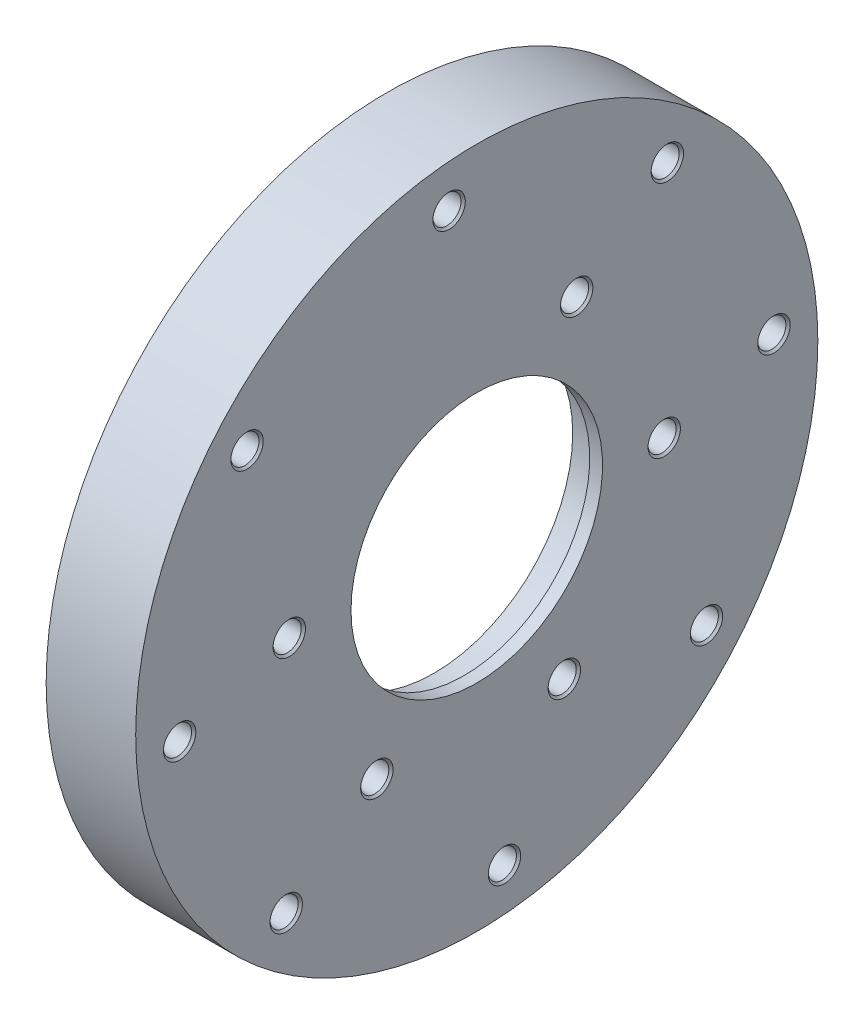
from build123d import *

# Parameters (mm, degrees)
SKETCH3_R          = 2.5
CUT_EXTRUDE1_DEPTH = 4
SKETCH6_R          = 3
CUT_EXTRUDE4_DEPTH = 11
SKETCH7_R          = 3.3
CUT_EXTRUDE5_DEPTH = 10
SKETCH9_R          = 1
CUT_EXTRUDE7_DEPTH = 2
CUT_EXTRUDE8_REACH = 117.07
SKETCH10_R         = 3.3
CHAMFER1_SIZE      = 0.5


with BuildPart() as part:
    # Sketch2 → Revolve1 (revolve)
    with BuildSketch(Plane.XY):
        Polygon((0, 80), (0, 52.5), (11, 52.5), (11, 32.5), (18, 32.5), (18, 29.5), (21, 29.5), (21, 80), align=None)
    revolve(axis=Axis((0, 0, 0), (1, 0, 0)))

    # Sketch3 → Cut-Extrude1 (cut)
    with BuildSketch(Plane.ZY):
        with Locations((0, 60)):
            Circle(SKETCH3_R)
        with Locations((12.077911205, 58.771796475)):
            Circle(SKETCH3_R)
        with Locations((23.661351307, 55.137468697)):
            Circle(SKETCH3_R)
        with Locations((34.276092906, 49.245806472)):
            Circle(SKETCH3_R)
        with Locations((43.487567234, 41.338015145)):
            Circle(SKETCH3_R)
        with Locations((50.91865545, 31.73784062)):
            Circle(SKETCH3_R)
        with Locations((56.265127929, 20.838315171)):
            Circle(SKETCH3_R)
        with Locations((59.30809946, 9.08566665)):
            Circle(SKETCH3_R)
        with Locations((59.92299043, -3.03895013)):
            Circle(SKETCH3_R)
        with Locations((58.084627132, -15.039151936)):
            Circle(SKETCH3_R)
        with Locations((53.868272374, -26.423649093)):
            Circle(SKETCH3_R)
        with Locations((47.446544216, -36.726358953)):
            Circle(SKETCH3_R)
        with Locations((39.082348963, -45.525487362)):
            Circle(SKETCH3_R)
        with Locations((29.118117752, -52.460796969)):
            Circle(SKETCH3_R)
        with Locations((17.961787378, -57.248355384)):
            Circle(SKETCH3_R)
        with Locations((6.070099319, -59.692159404)):
            Circle(SKETCH3_R)
        with Locations((-6.070099319, -59.692159404)):
            Circle(SKETCH3_R)
        with Locations((-17.961787378, -57.248355384)):
            Circle(SKETCH3_R)
        with Locations((-29.118117752, -52.460796969)):
            Circle(SKETCH3_R)
        with Locations((-39.082348963, -45.525487362)):
            Circle(SKETCH3_R)
        with Locations((-47.446544216, -36.726358953)):
            Circle(SKETCH3_R)
        with Locations((-53.868272374, -26.423649093)):
            Circle(SKETCH3_R)
        with Locations((-58.084627132, -15.039151936)):
            Circle(SKETCH3_R)
        with Locations((-59.92299043, -3.03895013)):
            Circle(SKETCH3_R)
        with Locations((-59.30809946, 9.08566665)):
            Circle(SKETCH3_R)
        with Locations((-56.265127929, 20.838315171)):
            Circle(SKETCH3_R)
        with Locations((-50.91865545, 31.73784062)):
            Circle(SKETCH3_R)
        with Locations((-43.487567234, 41.338015145)):
            Circle(SKETCH3_R)
        with Locations((-34.276092906, 49.245806472)):
            Circle(SKETCH3_R)
        with Locations((-23.661351307, 55.137468697)):
            Circle(SKETCH3_R)
        with Locations((-12.077911205, 58.771796475)):
            Circle(SKETCH3_R)
    extrude(amount=-CUT_EXTRUDE1_DEPTH, mode=Mode.SUBTRACT)

    # Sketch6 → Cut-Extrude4 (cut)
    with BuildSketch(Plane.ZY):
        with Locations((53.875586653, 44.692517973)):
            Circle(SKETCH6_R)
        with Locations((69.69817519, -6.493410136)):
            Circle(SKETCH6_R)
        with Locations((44.692517973, -53.875586653)):
            Circle(SKETCH6_R)
        with Locations((-6.493410136, -69.69817519)):
            Circle(SKETCH6_R)
        with Locations((-53.875586653, -44.692517973)):
            Circle(SKETCH6_R)
        with Locations((-69.69817519, 6.493410136)):
            Circle(SKETCH6_R)
        with Locations((-44.692517973, 53.875586653)):
            Circle(SKETCH6_R)
        with Locations((6.493410136, 69.69817519)):
            Circle(SKETCH6_R)
    extrude(amount=-CUT_EXTRUDE4_DEPTH, mode=Mode.SUBTRACT)

    # Sketch7 → Cut-Extrude5 (cut)
    with BuildSketch(Plane.ZY.offset(-21)):
        with Locations((53.875586653, 44.692517973)):
            Circle(SKETCH7_R)
        with Locations((69.69817519, -6.493410136)):
            Circle(SKETCH7_R)
        with Locations((44.692517973, -53.875586653)):
            Circle(SKETCH7_R)
        with Locations((-6.493410136, -69.69817519)):
            Circle(SKETCH7_R)
        with Locations((-53.875586653, -44.692517973)):
            Circle(SKETCH7_R)
        with Locations((-69.69817519, 6.493410136)):
            Circle(SKETCH7_R)
        with Locations((-44.692517973, 53.875586653)):
            Circle(SKETCH7_R)
        with Locations((6.493410136, 69.69817519)):
            Circle(SKETCH7_R)
    extrude(amount=CUT_EXTRUDE5_DEPTH, mode=Mode.SUBTRACT)

    # Sketch9 → Cut-Extrude7 (cut)
    with BuildSketch(Plane.ZY):
        with Locations((2.51770285, -71.46627686)):
            Circle(SKETCH9_R)
    extrude(amount=-CUT_EXTRUDE7_DEPTH, mode=Mode.SUBTRACT)

    # Sketch10 → Cut-Extrude8 (cut, up to next)
    with BuildSketch(Plane(origin=(21, 0, 0), x_dir=(0, 0, -1), z_dir=(1, 0, 0)), mode=Mode.PRIVATE) as cut_extrude8_sk1:
        with Locations((23.431880753, 37.241736861)):
            Circle(SKETCH10_R)
    cut_extrude8_tool1 = extrude(cut_extrude8_sk1.sketch, amount=-CUT_EXTRUDE8_REACH, mode=Mode.PRIVATE) & part.part
    # Sketch10 → Cut-Extrude8 (cut, up to next)
    with BuildSketch(Plane(origin=(21, 0, 0), x_dir=(0, 0, -1), z_dir=(1, 0, 0)), mode=Mode.PRIVATE) as cut_extrude8_sk2:
        with Locations((20.536349826, -38.913472421)):
            Circle(SKETCH10_R)
    cut_extrude8_tool2 = extrude(cut_extrude8_sk2.sketch, amount=-CUT_EXTRUDE8_REACH, mode=Mode.PRIVATE) & part.part
    # Sketch10 → Cut-Extrude8 (cut, up to next)
    with BuildSketch(Plane(origin=(21, 0, 0), x_dir=(0, 0, -1), z_dir=(1, 0, 0)), mode=Mode.PRIVATE) as cut_extrude8_sk3:
        with Locations((-43.968230579, 1.67173556)):
            Circle(SKETCH10_R)
    cut_extrude8_tool3 = extrude(cut_extrude8_sk3.sketch, amount=-CUT_EXTRUDE8_REACH, mode=Mode.PRIVATE) & part.part
    # Sketch10 → Cut-Extrude8 (cut, up to next)
    with BuildSketch(Plane(origin=(21, 0, 0), x_dir=(0, 0, -1), z_dir=(1, 0, 0)), mode=Mode.PRIVATE) as cut_extrude8_sk4:
        with Locations((-23.431880753, -37.241736861)):
            Circle(SKETCH10_R)
    cut_extrude8_tool4 = extrude(cut_extrude8_sk4.sketch, amount=-CUT_EXTRUDE8_REACH, mode=Mode.PRIVATE) & part.part
    # Sketch10 → Cut-Extrude8 (cut, up to next)
    with BuildSketch(Plane(origin=(21, 0, 0), x_dir=(0, 0, -1), z_dir=(1, 0, 0)), mode=Mode.PRIVATE) as cut_extrude8_sk5:
        with Locations((43.968230579, -1.67173556)):
            Circle(SKETCH10_R)
    cut_extrude8_tool5 = extrude(cut_extrude8_sk5.sketch, amount=-CUT_EXTRUDE8_REACH, mode=Mode.PRIVATE) & part.part
    add(cut_extrude8_tool1.solids().sort_by_distance((21, 37.241737, -23.431881))[0], mode=Mode.SUBTRACT)
    add(cut_extrude8_tool2.solids().sort_by_distance((21, -38.913472, -20.53635))[0], mode=Mode.SUBTRACT)
    add(cut_extrude8_tool3.solids().sort_by_distance((21, 1.671736, 43.968231))[0], mode=Mode.SUBTRACT)
    add(cut_extrude8_tool4.solids().sort_by_distance((21, -37.241737, 23.431881))[0], mode=Mode.SUBTRACT)
    add(cut_extrude8_tool5.solids().sort_by_distance((21, -1.671736, -43.968231))[0], mode=Mode.SUBTRACT)

    # Chamfer1
    chamfer1_edges = [part.edges().sort_by_distance(p)[0] for p in [
        (21, -53.875586653, 41.392517973),
        (21, -69.69817519, -9.793410136),
        (21, -44.692517973, -57.175586653),
        (21, 6.493410136, -72.99817519),
        (21, 44.692517973, 50.575586653),
        (21, -6.493410136, 66.39817519),
        (21, 1.67173556, 47.268230579),
        (21, -38.913472421, -17.236349826),
        (21, 37.241736861, -20.131880753),
        (21, -37.241736861, 26.731880753),
        (21, -1.67173556, -40.668230579),
        (21, 69.69817519, 3.193410136),
        (21, 53.875586653, -47.992517973),
    ]]
    chamfer(chamfer1_edges, length=CHAMFER1_SIZE)


solid = part.part
